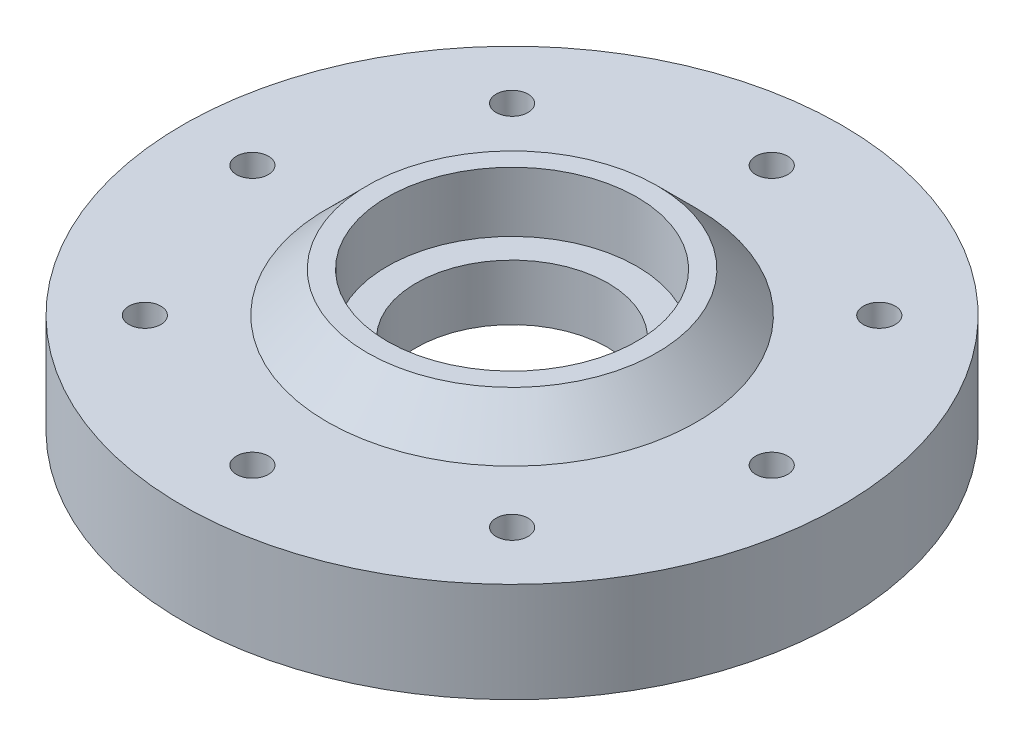
from build123d import *

# Parameters (mm, degrees)
SKETCH3_R          = 4
CUT_EXTRUDE2_DEPTH = 122.809277151


with BuildPart() as part:
    # Sketch2 → Revolve1 (revolve)
    with BuildSketch(Plane.XY):
        Polygon((82.5, 0), (56, 0), (56, 6), (24, 6), (24, 20), (31.256462168, 20), (31.256462168, 35), (36.256462168, 35), (46.256462168, 25), (82.5, 25), align=None)
    revolve(axis=Axis((0, 0, 0), (0, 1, 0)))

    # Sketch3 → Cut-Extrude2 (cut, through all)
    with BuildSketch(Plane.XZ):
        with Locations((65, 0)):
            Circle(SKETCH3_R)
        with Locations((45.961940777, -45.961940777)):
            Circle(SKETCH3_R)
        with Locations((0, -65)):
            Circle(SKETCH3_R)
        with Locations((-45.961940777, -45.961940777)):
            Circle(SKETCH3_R)
        with Locations((-65, 0)):
            Circle(SKETCH3_R)
        with Locations((-45.961940777, 45.961940777)):
            Circle(SKETCH3_R)
        with Locations((0, 65)):
            Circle(SKETCH3_R)
        with Locations((45.961940777, 45.961940777)):
            Circle(SKETCH3_R)
    extrude(amount=-CUT_EXTRUDE2_DEPTH, mode=Mode.SUBTRACT)


solid = part.part
